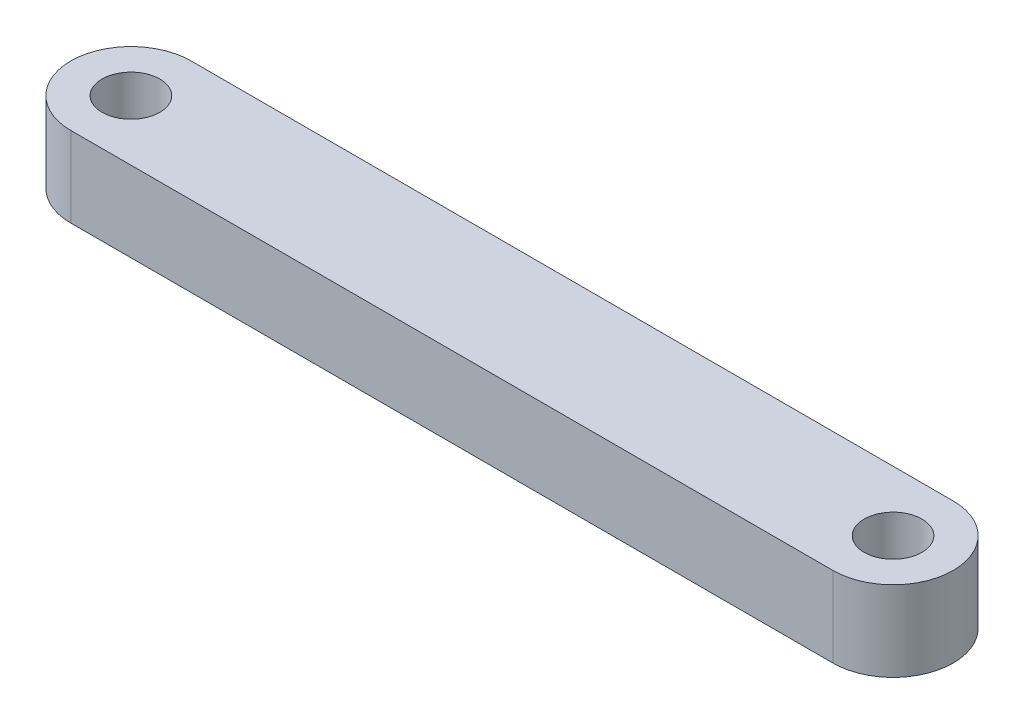
from build123d import *

# Parameters (mm, degrees)
SKETCH1_R           = 2.286
BOSS_EXTRUDE1_DEPTH = 6.35


with BuildPart() as part:
    # Sketch1 → Boss-Extrude1 (new body)
    with BuildSketch(Plane(origin=(0, 0, 0), x_dir=(1, 0, 0), z_dir=(0, 1, 0))):
        with BuildLine():
            Line((0, -4.7625), (-60.325, -4.7625))
            ThreePointArc((-60.325, -4.7625), (-65.0875, 0), (-60.325, 4.7625))
            Line((-60.325, 4.7625), (0, 4.7625))
            ThreePointArc((0, 4.7625), (4.7625, 0), (0, -4.7625))
        make_face()
        with Locations((-60.325, 0)):
            Circle(SKETCH1_R, mode=Mode.SUBTRACT)
        Circle(SKETCH1_R, mode=Mode.SUBTRACT)
    extrude(amount=BOSS_EXTRUDE1_DEPTH)


solid = part.part
